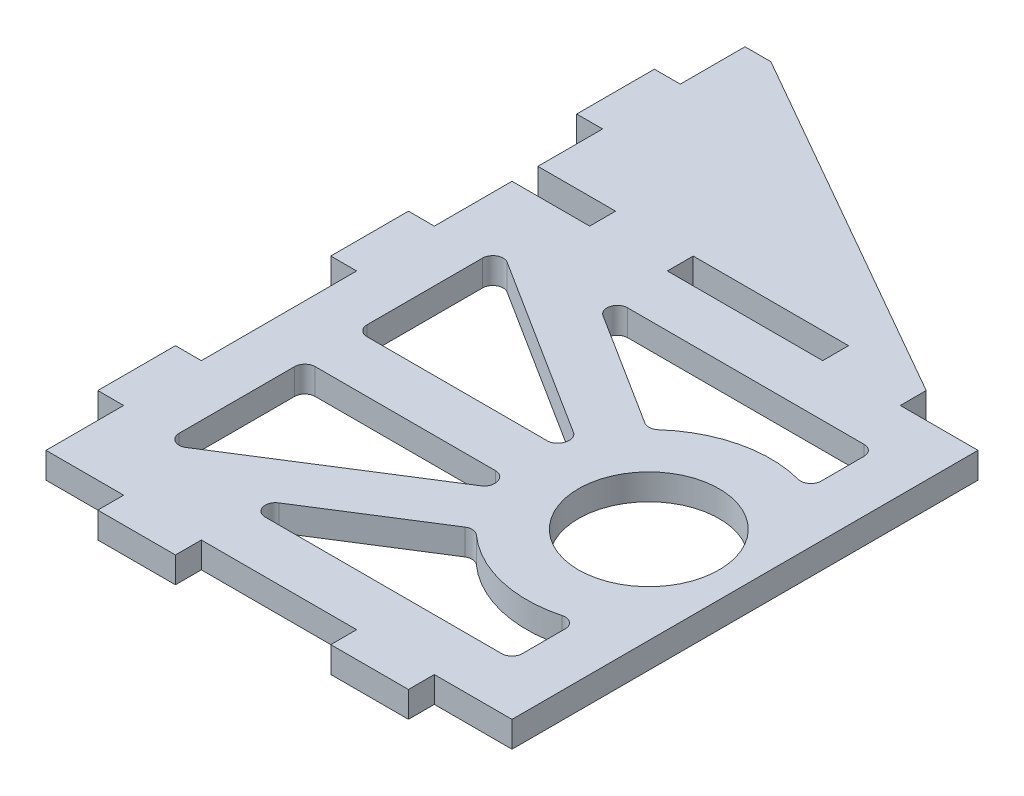
from build123d import *

# Parameters (mm, degrees)
BOSS_EXTRUDE1_DEPTH = 6.35
SKETCH2_R           = 17.250029
CUT_EXTRUDE1_DEPTH  = 167.316670842
CUT_EXTRUDE2_DEPTH  = 167.316670842
FILLET1_R           = 2.54
BOSS_EXTRUDE2_DEPTH = 6.35


with BuildPart() as part:
    # Sketch1 → Boss-Extrude1 (new body)
    with BuildSketch(Plane(origin=(0, 0, 0), x_dir=(1, 0, 0), z_dir=(0, 1, 0))):
        Polygon((0, 0), (19.05, 0), (19.05, -6.35), (38.1, -6.35), (38.1, 0), (76.2, 0), (76.2, -6.35), (95.25, -6.35), (95.25, 0), (114.3, 0), (114.3, 114.3), (95.25, 114.3), (95.25, 120.65), (76.2, 120.65), (76.2, 114.3), (38.1, 114.3), (38.1, 120.65), (19.05, 120.65), (19.05, 114.3), (0, 114.3), (0, 95.25), (-6.35, 95.25), (-6.35, 76.2), (0, 76.2), (0, 38.1), (-6.35, 38.1), (-6.35, 19.05), (0, 19.05), align=None)
    extrude(amount=-BOSS_EXTRUDE1_DEPTH)

    # Sketch2 → Cut-Extrude1 (cut, through all)
    with BuildSketch(Plane(origin=(0, 0, 0), x_dir=(1, 0, 0), z_dir=(0, 1, 0))):
        with Locations((90.699971, 57.15)):
            Circle(SKETCH2_R)
    extrude(amount=-CUT_EXTRUDE1_DEPTH, mode=Mode.SUBTRACT)

    # Sketch3 → Cut-Extrude2 (cut, through all)
    with BuildSketch(Plane(origin=(0, 0, 0), x_dir=(1, 0, 0), z_dir=(0, 1, 0))):
        with BuildLine():
            ThreePointArc((61.430844995, 63.5), (61.932862595, 65.484129297), (62.569215567, 67.429340245))
            Line((62.569215567, 67.429340245), (12.7, 98.972041843))
            Line((12.7, 98.972041843), (12.7, 63.5))
            Line((12.7, 63.5), (61.430844995, 63.5))
        make_face()
        with BuildLine():
            Line((12.7, 15.327958157), (62.569215567, 46.870659755))
            ThreePointArc((62.569215567, 46.870659755), (61.932862595, 48.815870703), (61.430844995, 50.8))
            Line((61.430844995, 50.8), (12.7, 50.8))
            Line((12.7, 50.8), (12.7, 15.327958157))
        make_face()
        with BuildLine():
            ThreePointArc((101.6, 29.253878318), (84.446639415, 27.860068604), (69.358057015, 36.137457447))
            Line((69.358057015, 36.137457447), (32.303284959, 12.7))
            Line((32.303284959, 12.7), (101.6, 12.7))
            Line((101.6, 12.7), (101.6, 29.253878318))
        make_face()
        with BuildLine():
            Line((32.303284959, 101.6), (69.358057015, 78.162542553))
            ThreePointArc((69.358057015, 78.162542553), (84.446639415, 86.439931396), (101.6, 85.046121682))
            Line((101.6, 85.046121682), (101.6, 101.6))
            Line((101.6, 101.6), (32.303284959, 101.6))
        make_face()
    extrude(amount=-CUT_EXTRUDE2_DEPTH, mode=Mode.SUBTRACT)

    # Fillet1
    fillet1_edges = [part.edges().sort_by_distance(p)[0] for p in [
        (61.430844995, -3.175, -63.5),
        (12.7, -3.175, -63.5),
        (62.569215567, -3.175, -67.429340245),
        (101.6, -3.175, -29.253878318),
        (101.6, -3.175, -12.7),
        (32.303284959, -3.175, -12.7),
        (69.358057015, -3.175, -36.137457447),
        (69.358057015, -3.175, -78.162542553),
        (32.303284959, -3.175, -101.6),
        (101.6, -3.175, -101.6),
        (101.6, -3.175, -85.046121682),
        (62.569215567, -3.175, -46.870659755),
        (12.7, -3.175, -15.327958157),
        (12.7, -3.175, -50.8),
        (61.430844995, -3.175, -50.8),
        (12.7, -3.175, -98.972041843),
    ]]
    fillet(fillet1_edges, radius=FILLET1_R)

    # Sketch4 → Boss-Extrude2 (add)
    with BuildSketch(Plane(origin=(0, 0, 0), x_dir=(1, 0, 0), z_dir=(0, 1, 0))):
        Polygon((0, 171.45), (6.35, 171.45), (95.25, 120.65), (19.05, 120.65), (0, 120.65), (0, 136.525), (-6.35, 136.525), (-6.35, 155.575), (0, 155.575), align=None)
    extrude(amount=-BOSS_EXTRUDE2_DEPTH)


solid = part.part
